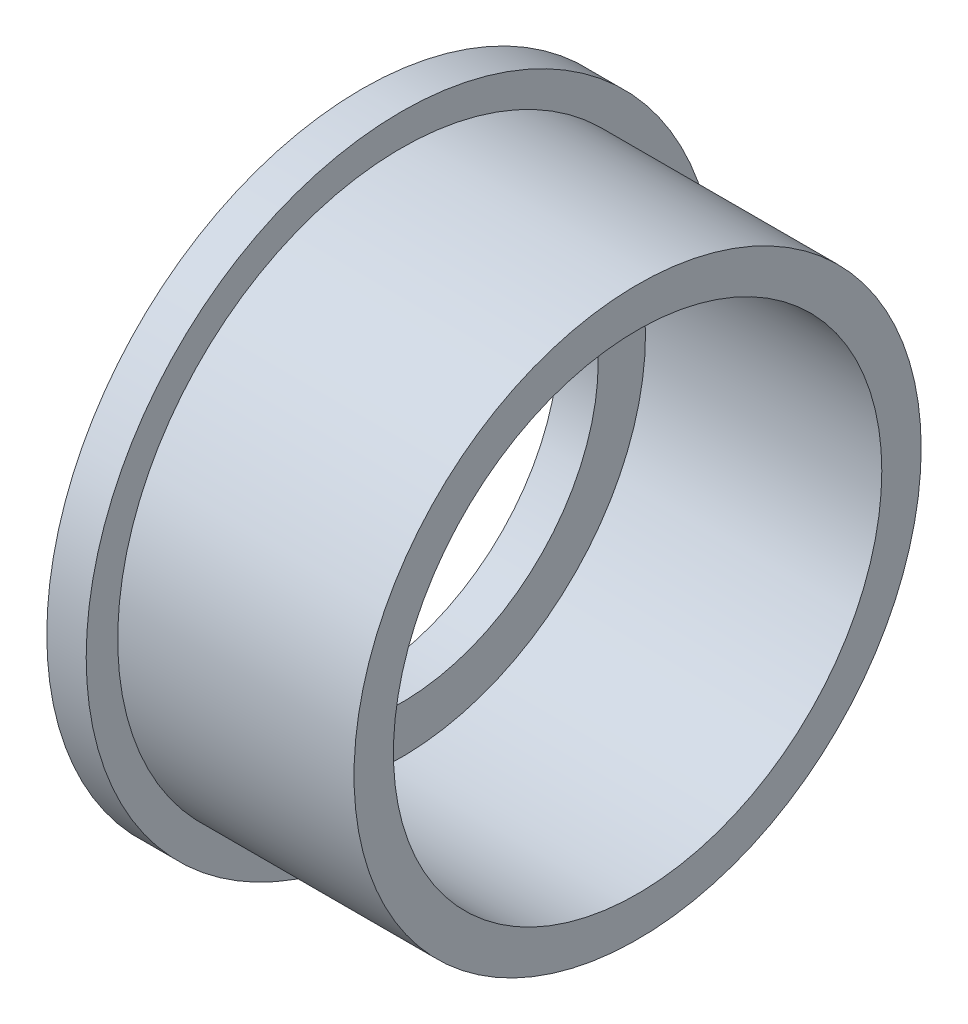
from build123d import *

# Parameters (mm, degrees)
SKETCH1_R           = 8
SKETCH1_R_2         = 5
BOSS_EXTRUDE1_DEPTH = 1
SKETCH2_R           = 7.2
SKETCH2_R_2         = 6.2
BOSS_EXTRUDE2_DEPTH = 6


with BuildPart() as part:
    # Sketch1 → Boss-Extrude1 (new body)
    with BuildSketch(Plane.YZ):
        Circle(SKETCH1_R)
        Circle(SKETCH1_R_2, mode=Mode.SUBTRACT)
    extrude(amount=BOSS_EXTRUDE1_DEPTH)

    # Sketch2 → Boss-Extrude2 (add)
    with BuildSketch(Plane.YZ.offset(1)):
        Circle(SKETCH2_R)
        Circle(SKETCH2_R_2, mode=Mode.SUBTRACT)
    extrude(amount=BOSS_EXTRUDE2_DEPTH)


solid = part.part
